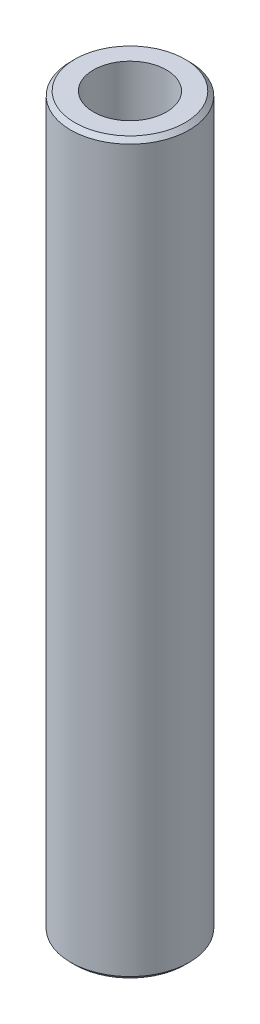
from build123d import *

# Parameters (mm, degrees)
SKETCH1_R           = 35
BOSS_EXTRUDE1_DEPTH = 430.609199674
SKETCH2_R           = 21.547141266
CUT_EXTRUDE1_DEPTH  = 434.44467103
CHAMFER1_SIZE       = 2.489738356


with BuildPart() as part:
    # Sketch1 → Boss-Extrude1 (new body)
    with BuildSketch(Plane(origin=(0, 0, 0), x_dir=(1, 0, 0), z_dir=(0, 1, 0))):
        Circle(SKETCH1_R)
    extrude(amount=BOSS_EXTRUDE1_DEPTH)

    # Sketch2 → Cut-Extrude1 (cut, through all)
    with BuildSketch(Plane(origin=(0, 0, 0), x_dir=(1, 0, 0), z_dir=(0, 1, 0))):
        Circle(SKETCH2_R)
    extrude(amount=CUT_EXTRUDE1_DEPTH, mode=Mode.SUBTRACT)

    # Chamfer1
    chamfer1_edges = [part.edges().sort_by_distance(p)[0] for p in [
        (-35, 430.609199674, 0),
        (-35, 0, 0),
    ]]
    chamfer(chamfer1_edges, length=CHAMFER1_SIZE)


solid = part.part
